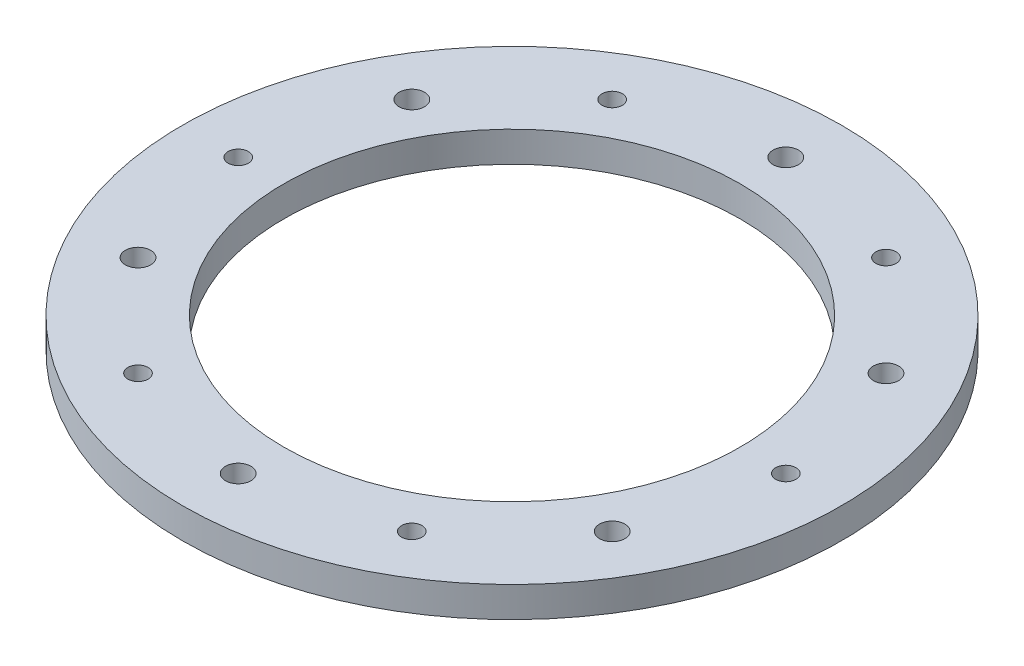
from build123d import *

# Parameters (mm, degrees)
SKETCH1_R           = 32.5
SKETCH1_R_2         = 1.25
BOSS_EXTRUDE1_DEPTH = 3
SKETCH2_R           = 22.5
SKETCH2_R_2         = 1
CUT_EXTRUDE1_DEPTH  = 3


with BuildPart() as part:
    # Sketch1 → Boss-Extrude1 (new body)
    with BuildSketch(Plane(origin=(0, 0, 0), x_dir=(1, 0, 0), z_dir=(0, 1, 0))):
        Circle(SKETCH1_R)
        with Locations((0, 27)):
            Circle(SKETCH1_R_2, mode=Mode.SUBTRACT)
        with Locations((23.382685902, 13.5)):
            Circle(SKETCH1_R_2, mode=Mode.SUBTRACT)
        with Locations((23.382685902, -13.5)):
            Circle(SKETCH1_R_2, mode=Mode.SUBTRACT)
        with Locations((0, -27)):
            Circle(SKETCH1_R_2, mode=Mode.SUBTRACT)
        with Locations((-23.382685902, -13.5)):
            Circle(SKETCH1_R_2, mode=Mode.SUBTRACT)
        with Locations((-23.382685902, 13.5)):
            Circle(SKETCH1_R_2, mode=Mode.SUBTRACT)
    extrude(amount=BOSS_EXTRUDE1_DEPTH)

    # Sketch2 → Cut-Extrude1 (cut)
    with BuildSketch(Plane(origin=(0, 3, 0), x_dir=(1, 0, 0), z_dir=(0, 1, 0))):
        Circle(SKETCH2_R)
        with Locations((-13.5, 23.382685902)):
            Circle(SKETCH2_R_2)
        with Locations((13.5, 23.382685902)):
            Circle(SKETCH2_R_2)
        with Locations((27, 0)):
            Circle(SKETCH2_R_2)
        with Locations((13.5, -23.382685902)):
            Circle(SKETCH2_R_2)
        with Locations((-13.5, -23.382685902)):
            Circle(SKETCH2_R_2)
        with Locations((-27, 0)):
            Circle(SKETCH2_R_2)
    extrude(amount=-CUT_EXTRUDE1_DEPTH, mode=Mode.SUBTRACT)


solid = part.part
